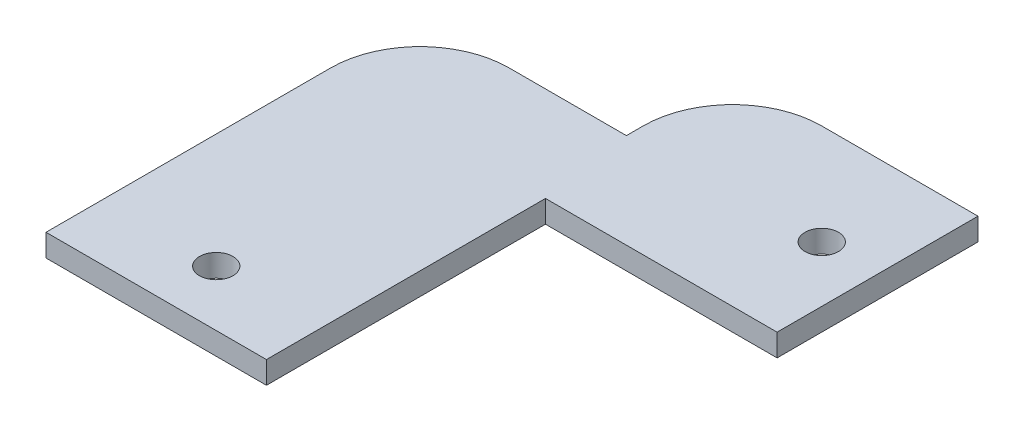
from build123d import *

# Parameters (mm, degrees)
SKETCH1_R           = 1.5
BOSS_EXTRUDE1_DEPTH = 2


with BuildPart() as part:
    # Sketch1 → Boss-Extrude1 (new body)
    with BuildSketch(Plane(origin=(0, 0, 0), x_dir=(1, 0, 0), z_dir=(0, 1, 0))):
        with BuildLine():
            Line((0, 0), (19.75, 0))
            Line((19.75, 0), (19.75, 25))
            Line((19.75, 25), (40.5, 25))
            Line((40.5, 25), (40.5, 43))
            Line((40.5, 43), (26.5, 43))
            ThreePointArc((26.5, 43), (20.843145751, 40.656854249), (18.5, 35))
            Line((18.5, 35), (18.5, 33.5))
            Line((18.5, 33.5), (8, 33.5))
            ThreePointArc((8, 33.5), (2.343145751, 31.156854249), (0, 25.5))
            Line((0, 25.5), (0, 0))
        make_face()
        with Locations((10.25, 5)):
            Circle(SKETCH1_R, mode=Mode.SUBTRACT)
        with Locations((35.5, 34)):
            Circle(SKETCH1_R, mode=Mode.SUBTRACT)
    extrude(amount=BOSS_EXTRUDE1_DEPTH)


solid = part.part
